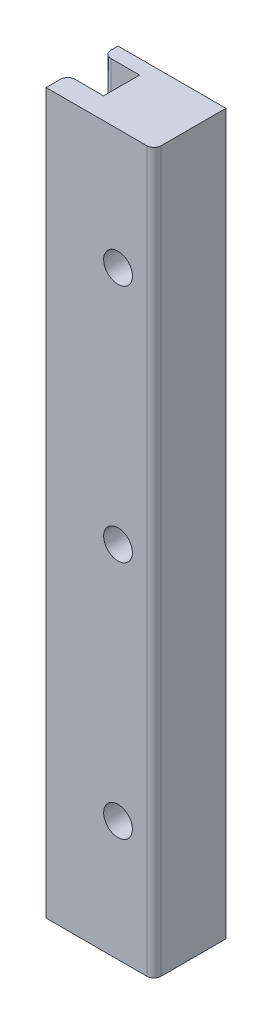
from build123d import *

# Parameters (mm, degrees)
BOSS_EXTRUDE1_DEPTH = 100
FILLET1_R           = 1
SKETCH2_R           = 2
CUT_EXTRUDE1_DEPTH  = 10


with BuildPart() as part:
    # Sketch1 → Boss-Extrude1 (new body)
    with BuildSketch(Plane(origin=(0, 0, 0), x_dir=(1, 0, 0), z_dir=(0, 1, 0))):
        Polygon((0, 0), (15, 0), (15, -2), (15, -10), (7, -10), (0, -10), (0, -7), (5, -7), (5, -2), (0, -2), align=None)
    extrude(amount=BOSS_EXTRUDE1_DEPTH)

    # Fillet1
    fillet1_edges = [part.edges().sort_by_distance(p)[0] for p in [
        (0, 50, 7),
        (0, 50, 2),
        (15, 50, 10),
    ]]
    fillet(fillet1_edges, radius=FILLET1_R)

    # Sketch2 → Cut-Extrude1 (cut)
    with BuildSketch(Plane.XY.offset(10)):
        with Locations((10, 50)):
            Circle(SKETCH2_R)
        with Locations((10, 83.3)):
            Circle(SKETCH2_R)
        with Locations((10, 16.7)):
            Circle(SKETCH2_R)
    extrude(amount=-CUT_EXTRUDE1_DEPTH, mode=Mode.SUBTRACT)


solid = part.part
